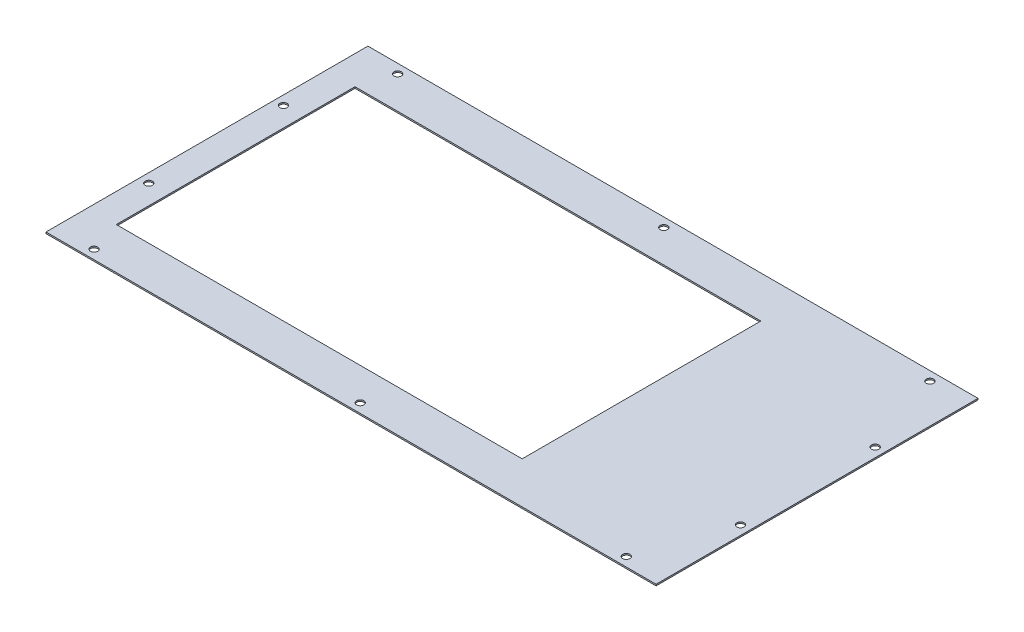
from build123d import *

# Parameters (mm, degrees)
SKETCH1_W          = 332.4
SKETCH1_H          = 175.4
SKETCH1_R          = 2
BASE_FLANGE1_DEPTH = 0.8
SKETCH2_W          = 221.12
SKETCH2_H          = 130.07
CUT_EXTRUDE1_DEPTH = 10


# Sheet-metal steps are written as plain solids
with BuildPart() as part:
    # Sketch1 → Base-Flange1 (new body)
    with BuildSketch(Plane(origin=(0, 0, 0), x_dir=(1, 0, 0), z_dir=(0, 1, 0))):
        Rectangle(SKETCH1_W, SKETCH1_H)
        with Locations(Location((0, 82.7, 0), (0, 0, 270))):
            Circle(SKETCH1_R, mode=Mode.SUBTRACT)
        with Locations(Location((145, 82.7, 0), (0, 0, 270))):
            Circle(SKETCH1_R, mode=Mode.SUBTRACT)
        with Locations(Location((-145, 82.7, 0), (0, 0, 270))):
            Circle(SKETCH1_R, mode=Mode.SUBTRACT)
        with Locations(Location((-161.2, 36.7, 0), (0, 0, 270))):
            Circle(SKETCH1_R, mode=Mode.SUBTRACT)
        with Locations(Location((161.2, 36.7, 0), (0, 0, 90))):
            Circle(SKETCH1_R, mode=Mode.SUBTRACT)
        with Locations(Location((161.2, -36.7, 0), (0, 0, 270))):
            Circle(SKETCH1_R, mode=Mode.SUBTRACT)
        with Locations(Location((145, -82.7, 0), (0, 0, 90))):
            Circle(SKETCH1_R, mode=Mode.SUBTRACT)
        with Locations(Location((0, -82.7, 0), (0, 0, 90))):
            Circle(SKETCH1_R, mode=Mode.SUBTRACT)
        with Locations(Location((-145, -82.7, 0), (0, 0, 90))):
            Circle(SKETCH1_R, mode=Mode.SUBTRACT)
        with Locations(Location((-161.2, -36.7, 0), (0, 0, 90))):
            Circle(SKETCH1_R, mode=Mode.SUBTRACT)
    extrude(amount=-BASE_FLANGE1_DEPTH)

    # Sketch2 → Cut-Extrude1 (cut)
    with BuildSketch(Plane(origin=(0, 0, 0), x_dir=(1, 0, 0), z_dir=(0, 1, 0))):
        with Locations((-40, 0)):
            Rectangle(SKETCH2_W, SKETCH2_H)
    extrude(amount=-CUT_EXTRUDE1_DEPTH, mode=Mode.SUBTRACT)


solid = part.part
